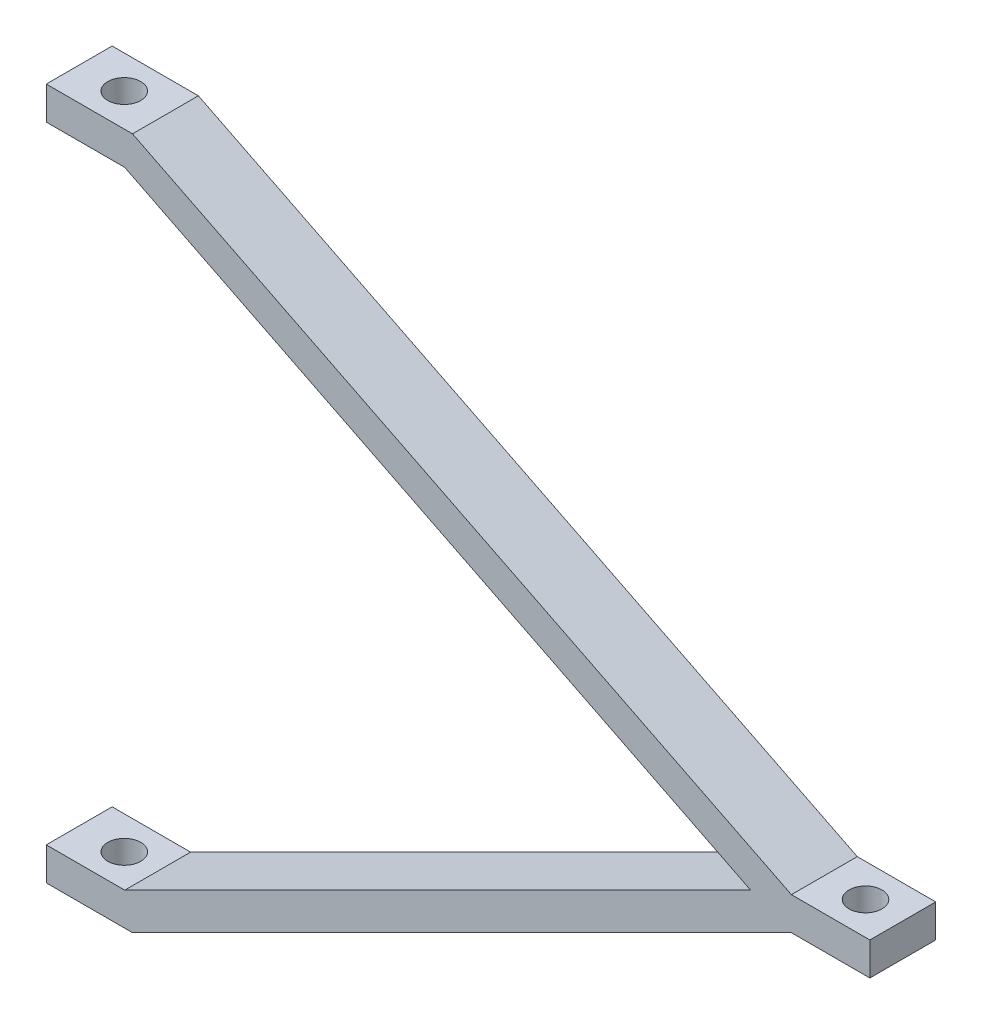
from build123d import *

# Parameters (mm, degrees)
EXTRUDE_THIN4_DEPTH = 20
SKETCH2_R           = 5
CUT_EXTRUDE1_DEPTH  = 235


# Read off the part's stored shape, not the designer's step: Extrude-Thin4
with BuildPart() as part:
    # Extrude-Thin4 outline → Extrude-Thin4 (new body)
    with BuildSketch(Plane.XY):
        Polygon((201.180339887, 5), (1.180339887, 105), (-25, 105), (-25, 95), (-1.180339887, 95), (188.819660113, 0), (-1.180339887, -95), (-25, -95), (-25, -105), (1.180339887, -105), (201.180339887, -5), (225, -5), (225, 5), align=None)
    extrude(amount=EXTRUDE_THIN4_DEPTH)

    # Sketch2 → Cut-Extrude1 (cut)
    with BuildSketch(Plane.XZ.offset(105)):
        with Locations(Location((-11.319660113, 10, 0), (0, 0, 270))):
            Circle(SKETCH2_R)
        with Locations(Location((213.680339887, 10, 0), (0, 0, 180))):
            Circle(SKETCH2_R)
    extrude(amount=-CUT_EXTRUDE1_DEPTH, mode=Mode.SUBTRACT)


solid = part.part
